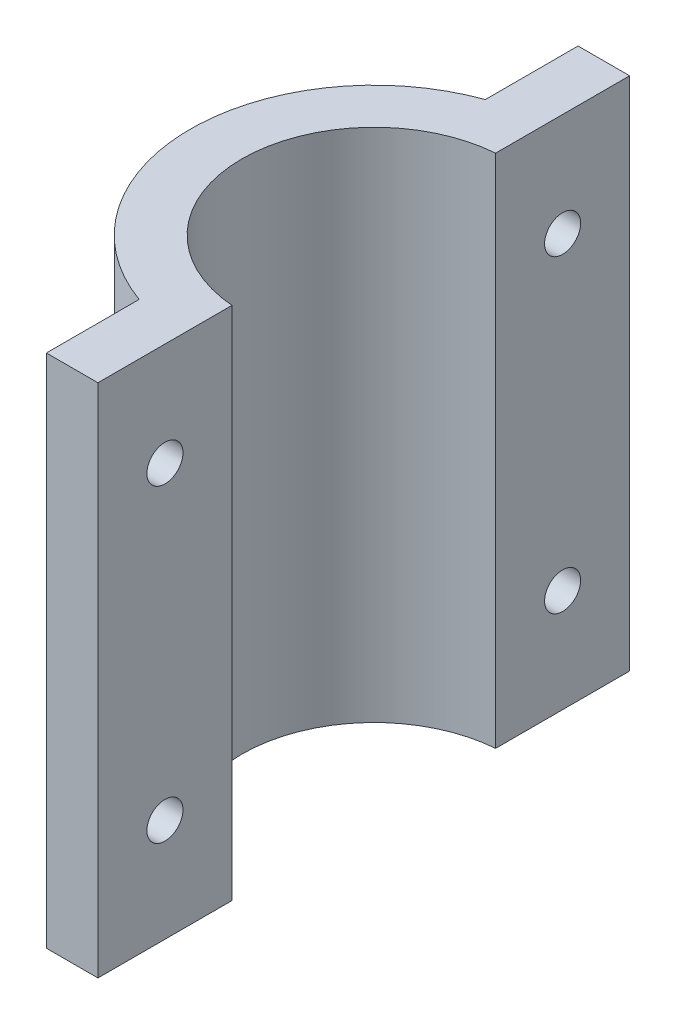
from build123d import *

# Parameters (mm, degrees)
BOSS_EXTRUDE4_DEPTH = 50
SKETCH7_R           = 1.75
CUT_EXTRUDE1_DEPTH  = 59.719147195


with BuildPart() as part:
    # Sketch6 → Boss-Extrude4 (new body)
    with BuildSketch(Plane.XZ):
        with BuildLine():
            Line((-1, 25.784833184), (-1, 12.785954208))
            ThreePointArc((-1, 12.785954208), (-12.825, 0), (-1, -12.785954208))
            Line((-1, -12.785954208), (-1, -25.784833184))
            Line((-1, -25.784833184), (-6, -25.784833184))
            Line((-6, -25.784833184), (-6, -16.784833184))
            ThreePointArc((-6, -16.784833184), (-17.825, 0), (-6, 16.784833184))
            Line((-6, 16.784833184), (-6, 25.784833184))
            Line((-6, 25.784833184), (-1, 25.784833184))
        make_face()
    extrude(amount=BOSS_EXTRUDE4_DEPTH)

    # Sketch7 → Cut-Extrude1 (cut, through all)
    with BuildSketch(Plane(origin=(-1, 0, 0), x_dir=(0, 0, -1), z_dir=(1, 0, 0))):
        with Locations((-19.285393696, -10)):
            Circle(SKETCH7_R)
        with Locations((-19.285393696, -40)):
            Circle(SKETCH7_R)
        with Locations((19.285393696, -40)):
            Circle(SKETCH7_R)
        with Locations((19.285393696, -10)):
            Circle(SKETCH7_R)
    extrude(amount=-CUT_EXTRUDE1_DEPTH, mode=Mode.SUBTRACT)


solid = part.part
